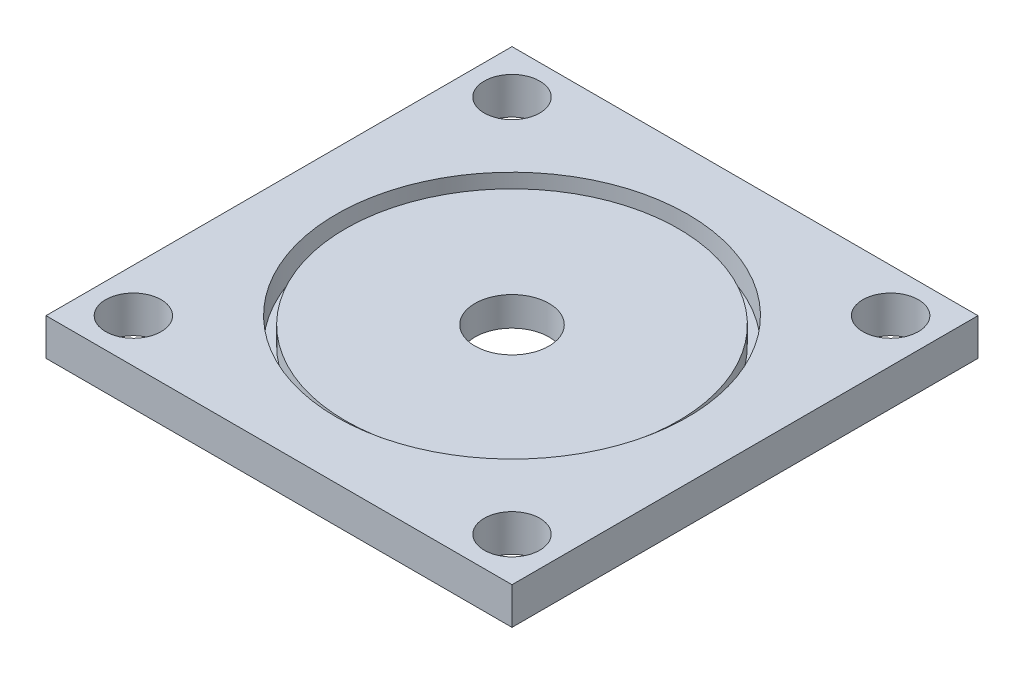
from build123d import *

# Parameters (mm, degrees)
PLATEOUTLINE_W      = 80
PLATEOUTLINE_H      = 80
BOSS_EXTRUDE1_DEPTH = 6.35
RAILGUIDES_R        = 4.7625
CUT_EXTRUDE1_DEPTH  = 10
CUT_EXTRUDE2_START  = 5
FUELGRAINMOUNTING_R = 30.1625
CUT_EXTRUDE2_DEPTH  = 5
GASINTAKE_R         = 6.35
CUT_EXTRUDE3_DEPTH  = 5
CUT_EXTRUDE4_START  = 1.825
SKETCH1_R           = 30.1625
SKETCH1_R_2         = 28.575
CUT_EXTRUDE4_DEPTH  = 3.175


with BuildPart() as part:
    # plateOutline → Boss-Extrude1 (new body)
    with BuildSketch(Plane(origin=(0, 0, 0), x_dir=(1, 0, 0), z_dir=(0, 1, 0))):
        Rectangle(PLATEOUTLINE_W, PLATEOUTLINE_H)
    extrude(amount=BOSS_EXTRUDE1_DEPTH)

    # railGuides → Cut-Extrude1 (cut)
    with BuildSketch(Plane(origin=(0, 0, 0), x_dir=(1, 0, 0), z_dir=(0, 1, 0))):
        with Locations((-32.5, 32.5)):
            Circle(RAILGUIDES_R)
        with Locations((32.5, 32.5)):
            Circle(RAILGUIDES_R)
        with Locations((32.5, -32.5)):
            Circle(RAILGUIDES_R)
        with Locations((-32.5, -32.5)):
            Circle(RAILGUIDES_R)
    extrude(amount=CUT_EXTRUDE1_DEPTH, mode=Mode.SUBTRACT)

    # FuelGrainMounting → Cut-Extrude2 (cut)
    with BuildSketch(Plane(origin=(0, 0, 0), x_dir=(1, 0, 0), z_dir=(0, 1, 0)).offset(CUT_EXTRUDE2_START)):
        Circle(FUELGRAINMOUNTING_R)
    extrude(amount=CUT_EXTRUDE2_DEPTH, mode=Mode.SUBTRACT)

    # GasIntake → Cut-Extrude3 (cut)
    with BuildSketch(Plane(origin=(0, 0, 0), x_dir=(1, 0, 0), z_dir=(0, 1, 0))):
        Circle(GASINTAKE_R)
    extrude(amount=CUT_EXTRUDE3_DEPTH, mode=Mode.SUBTRACT)

    # Sketch1 → Cut-Extrude4 (cut)
    with BuildSketch(Plane(origin=(0, 0, 0), x_dir=(1, 0, 0), z_dir=(0, 1, 0)).offset(CUT_EXTRUDE4_START)):
        Circle(SKETCH1_R)
        Circle(SKETCH1_R_2, mode=Mode.SUBTRACT)
    extrude(amount=CUT_EXTRUDE4_DEPTH, mode=Mode.SUBTRACT)


solid = part.part
